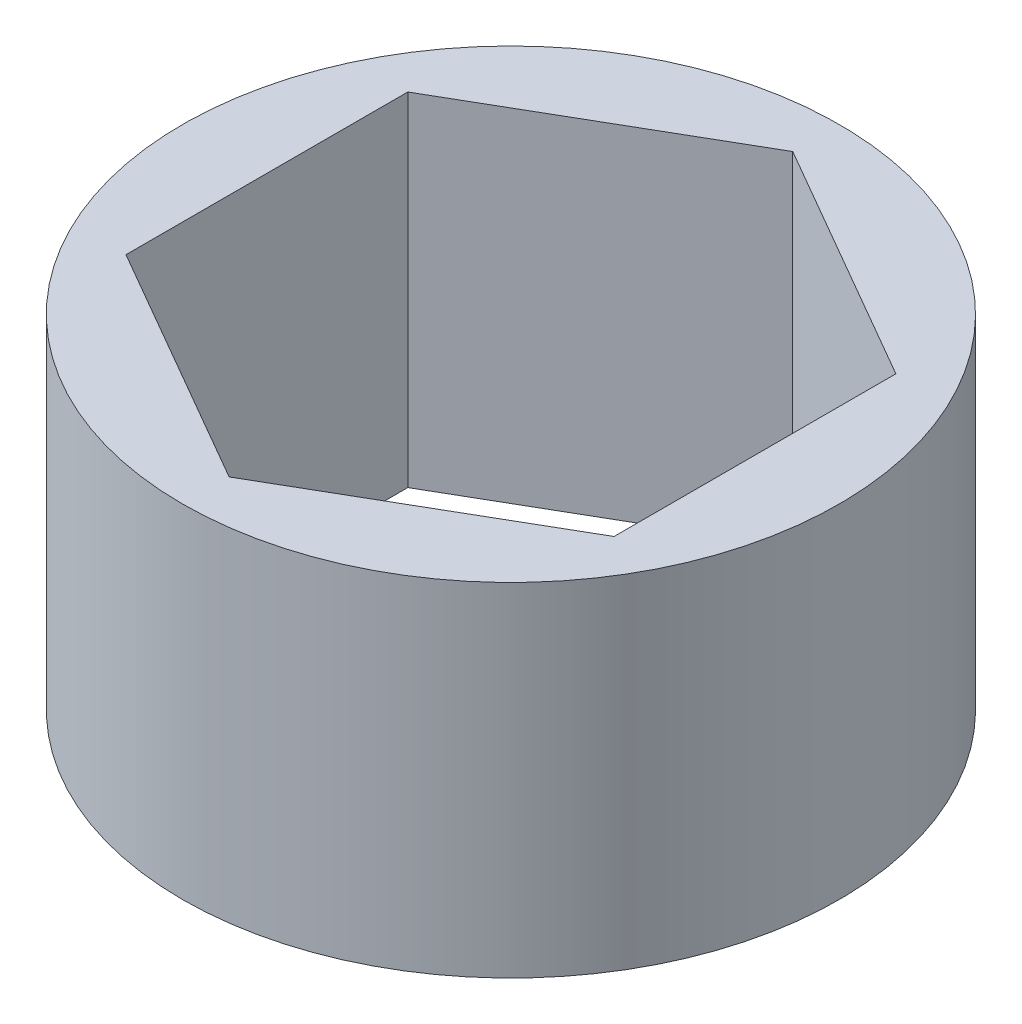
from build123d import *

# Parameters (mm, degrees)
SKETCH1_R           = 8.89
BOSS_EXTRUDE1_DEPTH = 4.6355


with BuildPart() as part:
    # Sketch1 → Boss-Extrude1 (new, symmetric)
    with BuildSketch(Plane(origin=(0, 0, 0), x_dir=(1, 0, 0), z_dir=(0, 1, 0))):
        Circle(SKETCH1_R)
        Polygon((0, 7.625642355), (-6.604, 3.812821178), (-6.604, -3.812821178), (0, -7.625642355), (6.604, -3.812821178), (6.604, 3.812821178), align=None, mode=Mode.SUBTRACT)
    extrude(amount=BOSS_EXTRUDE1_DEPTH, both=True)


solid = part.part
